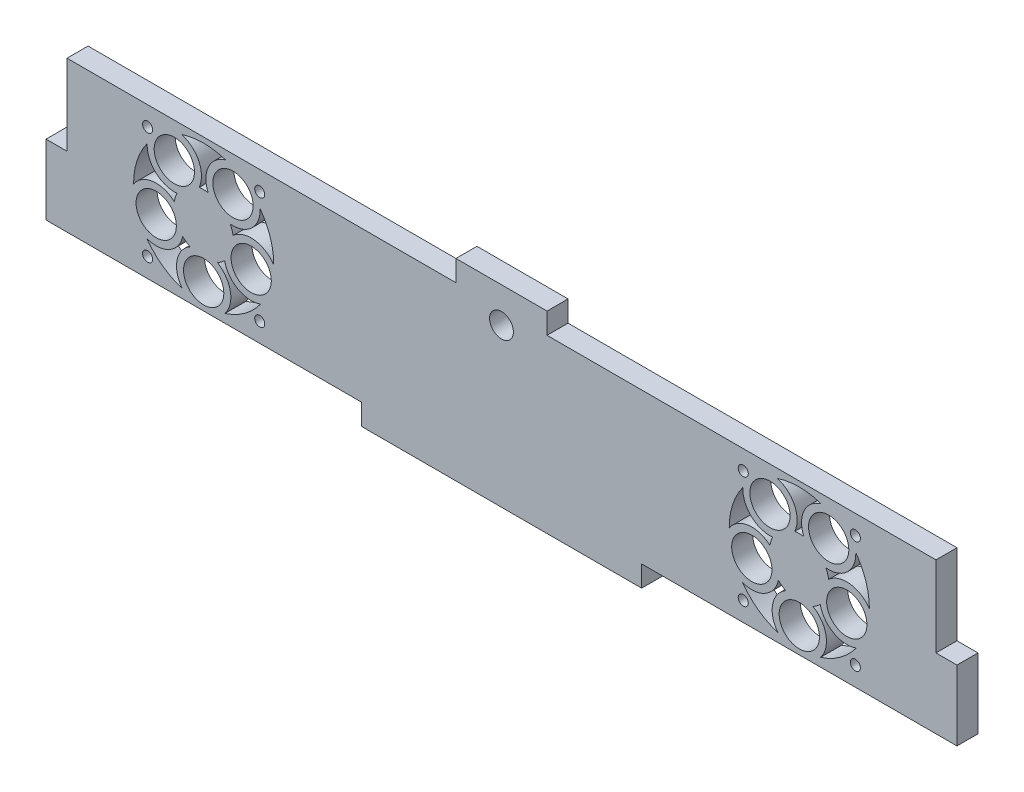
from build123d import *

# Parameters (mm, degrees)
SKETCH1_W                      = 260
SKETCH1_H                      = 49
BOSS_EXTRUDE1_DEPTH            = 6
SKETCH2_W                      = 117
SKETCH2_H                      = 6
CUT_EXTRUDE1_DEPTH             = 140.057542046
SKETCH5_W                      = 3.4
SKETCH5_H                      = 6
CUT_EXTRUDE2_REACH             = 141.058
SKETCH6_W                      = 6
SKETCH6_H                      = 23
SKETCH7_W                      = 80
SKETCH7_H                      = 6
BOSS_EXTRUDE2_DEPTH            = 6
SKETCH8_R                      = 20
SKETCH8_R_2                    = 8.5
CUT_EXTRUDE3_DEPTH             = 6
SKETCH9_R                      = 5.75
BOSS_EXTRUDE3_DEPTH            = 6
CIRPATTERN1_COUNT              = 5
SKETCH11_W                     = 1.4351
SKETCH11_H                     = 6
F_6_40_TAPPED_HOLE1_AT_2_COUNT = 2
F_6_40_TAPPED_HOLE1_AT_2_PITCH = 32
F_6_40_TAPPED_HOLE1_AT_3_COUNT = 2
F_6_40_TAPPED_HOLE1_AT_3_PITCH = 45.254833996
F_6_40_TAPPED_HOLE1_AT_4_COUNT = 2
F_6_40_TAPPED_HOLE1_AT_4_PITCH = 32
SKETCH12_R                     = 1.4351
SKETCH12_R_2                   = 3.4
SKETCH12_R_3                   = 5.75
CUT_EXTRUDE4_DEPTH             = 6


with BuildPart() as part:
    # Sketch1 → Boss-Extrude1 (new body)
    with BuildSketch(Plane.XY):
        with Locations((0, 24.5)):
            Rectangle(SKETCH1_W, SKETCH1_H)
    extrude(amount=BOSS_EXTRUDE1_DEPTH)

    # Sketch2 → Cut-Extrude1 (cut, through all)
    with BuildSketch(Plane(origin=(0, 0, 0), x_dir=(-1, 0, 0), z_dir=(0, 0, -1))):
        with Locations((-71.5, 46)):
            Rectangle(SKETCH2_W, SKETCH2_H)
        with Locations((71.5, 46)):
            Rectangle(SKETCH2_W, SKETCH2_H)
    extrude(amount=-CUT_EXTRUDE1_DEPTH, mode=Mode.SUBTRACT)

    # Sketch5 → M8x1.25 Tapped Hole1 (revolve, cut)
    with BuildSketch(Plane(origin=(0, 39, 0), x_dir=(0, 1, 0), z_dir=(1, 0, 0))):
        with Locations((1.7, 3)):
            Rectangle(SKETCH5_W, SKETCH5_H)
    revolve(axis=Axis((0, 39, -6.35), (0, 0, 1)), mode=Mode.SUBTRACT)

    # Sketch6 → Cut-Extrude2 (cut, up to next)
    with BuildSketch(Plane(origin=(0, 0, 0), x_dir=(-1, 0, 0), z_dir=(0, 0, -1)), mode=Mode.PRIVATE) as cut_extrude2_sk1:
        with Locations((-127, 31.5)):
            Rectangle(SKETCH6_W, SKETCH6_H)
    cut_extrude2_tool1 = extrude(cut_extrude2_sk1.sketch, amount=-CUT_EXTRUDE2_REACH, mode=Mode.PRIVATE) & part.part
    # Sketch6 → Cut-Extrude2 (cut, up to next)
    with BuildSketch(Plane(origin=(0, 0, 0), x_dir=(-1, 0, 0), z_dir=(0, 0, -1)), mode=Mode.PRIVATE) as cut_extrude2_sk2:
        with Locations((127, 31.5)):
            Rectangle(SKETCH6_W, SKETCH6_H)
    cut_extrude2_tool2 = extrude(cut_extrude2_sk2.sketch, amount=-CUT_EXTRUDE2_REACH, mode=Mode.PRIVATE) & part.part
    add(cut_extrude2_tool1.solids().sort_by_distance((127, 31.5, 0))[0], mode=Mode.SUBTRACT)
    add(cut_extrude2_tool2.solids().sort_by_distance((-127, 31.5, 0))[0], mode=Mode.SUBTRACT)

    # Sketch7 → Boss-Extrude2 (add)
    with BuildSketch(Plane(origin=(0, 0, 0), x_dir=(-1, 0, 0), z_dir=(0, 0, -1))):
        with Locations((0, -3)):
            Rectangle(SKETCH7_W, SKETCH7_H)
    extrude(amount=-BOSS_EXTRUDE2_DEPTH)

    # Sketch8 → Cut-Extrude3 (cut)
    with BuildSketch(Plane(origin=(0, 0, 0), x_dir=(-1, 0, 0), z_dir=(0, 0, -1))):
        with Locations((-85, 21.5)):
            Circle(SKETCH8_R)
        with Locations((-85, 21.5)):
            Circle(SKETCH8_R_2, mode=Mode.SUBTRACT)
    extrude(amount=-CUT_EXTRUDE3_DEPTH, mode=Mode.SUBTRACT)


with BuildPart() as cut_extrude3_piece_1:
    # of the separate pieces the step leaves, piece 1, a body of its own (cut_extrude3_pieces)
    add(part.part.solids().sort_by_distance((130, 0, 0))[0])



with BuildPart() as cut_extrude3_piece_2:
    # of the separate pieces the step leaves, piece 2, a body of its own (cut_extrude3_pieces)
    add(part.part.solids().sort_by_distance((76.5, 21.5, 0))[0])


with BuildPart() as cut_extrude3_piece_1_1:
    add(cut_extrude3_piece_1.part)

    add(cut_extrude3_piece_2.part)  # Boss-Extrude3 merges Cut-Extrude3 piece 2
    # Sketch9 → Boss-Extrude3 (add)
    with BuildSketch(Plane(origin=(0, 0, 0), x_dir=(-1, 0, 0), z_dir=(0, 0, -1))):
        with BuildLine():
            ThreePointArc((-100.761482737, 35.377163324), (-88.82060414, 26.758610463), (-93.327400585, 40.778340164))
            ThreePointArc((-93.327400585, 40.778340164), (-97.343490298, 38.489356882), (-100.761482737, 35.377163324))
        make_face()
        with Locations((-93.375939845, 33.02849217)):
            Circle(SKETCH9_R, mode=Mode.SUBTRACT)
    boss_extrude3 = extrude(amount=-BOSS_EXTRUDE3_DEPTH)

    # CirPattern1: Boss-Extrude3 ×5 about axis
    cirpattern1_axis = Axis((85, 21.5, 0), (0, 0, -1))
    for i in range(1, CIRPATTERN1_COUNT):
        add(boss_extrude3.rotate(cirpattern1_axis, i * 360 / CIRPATTERN1_COUNT))

    # Sketch11 → #6-40 Tapped Hole1 (revolve, cut)
    with BuildSketch(Plane(origin=(101, 37.5, 0), x_dir=(0, 1, 0), z_dir=(1, 0, 0))):
        with Locations((0.71755, 3)):
            Rectangle(SKETCH11_W, SKETCH11_H)
    f_6_40_tapped_hole1 = revolve(axis=Axis((101, 37.5, -6.35), (0, 0, 1)), mode=Mode.SUBTRACT)

    # #6-40 Tapped Hole1 at 2: #6-40 Tapped Hole1 ×2
    with Locations(*[(-i * F_6_40_TAPPED_HOLE1_AT_2_PITCH, 0, 0) for i in range(1, F_6_40_TAPPED_HOLE1_AT_2_COUNT)]):
        add(f_6_40_tapped_hole1, mode=Mode.SUBTRACT)

    # #6-40 Tapped Hole1 at 3: #6-40 Tapped Hole1 ×2
    with Locations(*[Vector(-0.7071067811865476, -0.7071067811865476, 0) * (i * F_6_40_TAPPED_HOLE1_AT_3_PITCH) for i in range(1, F_6_40_TAPPED_HOLE1_AT_3_COUNT)]):
        add(f_6_40_tapped_hole1, mode=Mode.SUBTRACT)

    # #6-40 Tapped Hole1 at 4: #6-40 Tapped Hole1 ×2
    with Locations(*[(0, -i * F_6_40_TAPPED_HOLE1_AT_4_PITCH, 0) for i in range(1, F_6_40_TAPPED_HOLE1_AT_4_COUNT)]):
        add(f_6_40_tapped_hole1, mode=Mode.SUBTRACT)

    # Sketch12 → Cut-Extrude4 (cut)
    with BuildSketch(Plane(origin=(0, 0, 0), x_dir=(-1, 0, 0), z_dir=(0, 0, -1))):
        with Locations(Location((101, 37.5, 0), (0, 0, 180))):
            Circle(SKETCH12_R)
        with Locations((0, 39)):
            Circle(SKETCH12_R_2)
        with Locations((-93.375939845, 33.02849217)):
            Circle(SKETCH12_R_3)
        with Locations(Location((-76.624060155, 33.02849217, 0), (0, 0, 288))):
            Circle(SKETCH12_R_3)
        with Locations(Location((-71.447444643, 17.09650783, 0), (0, 0, 216))):
            Circle(SKETCH12_R_3)
        with Locations(Location((-85, 7.25, 0), (0, 0, 144))):
            Circle(SKETCH12_R_3)
        with Locations(Location((-98.552555357, 17.09650783, 0), (0, 0, 72))):
            Circle(SKETCH12_R_3)
        with Locations((-101, 5.5)):
            Circle(SKETCH12_R)
        with Locations((-69, 5.5)):
            Circle(SKETCH12_R)
        with Locations((-69, 37.5)):
            Circle(SKETCH12_R)
        with Locations((-101, 37.5)):
            Circle(SKETCH12_R)
        with Locations(Location((69, 37.5, 0), (0, 0, 180))):
            Circle(SKETCH12_R)
        with Locations(Location((69, 5.5, 0), (0, 0, 180))):
            Circle(SKETCH12_R)
        with Locations(Location((101, 5.5, 0), (0, 0, 180))):
            Circle(SKETCH12_R)
        with Locations(Location((98.552555357, 17.09650783, 0), (0, 0, 180))):
            Circle(SKETCH12_R_3)
        with Locations(Location((85, 7.25, 0), (0, 0, 180))):
            Circle(SKETCH12_R_3)
        with Locations(Location((71.447444643, 17.09650783, 0), (0, 0, 180))):
            Circle(SKETCH12_R_3)
        with Locations(Location((76.624060155, 33.02849217, 0), (0, 0, 180))):
            Circle(SKETCH12_R_3)
        with Locations(Location((93.375939845, 33.02849217, 0), (0, 0, 180))):
            Circle(SKETCH12_R_3)
        with BuildLine():
            ThreePointArc((-78.722018184, 40.489127003), (-83.633443041, 36.334706252), (-83.715608088, 29.902400694))
            ThreePointArc((-83.715608088, 29.902400694), (-85, 30), (-86.284391912, 29.902400694))
            ThreePointArc((-86.284391912, 29.902400694), (-86.366556959, 36.334706252), (-91.277981816, 40.489127003))
            ThreePointArc((-91.277981816, 40.489127003), (-85, 41.5), (-78.722018184, 40.489127003))
        make_face()
        with BuildLine():
            ThreePointArc((-65.000263954, 21.397247437), (-65.978869674, 27.680339887), (-68.880270097, 33.338678467))
            ThreePointArc((-68.880270097, 33.338678467), (-71.313645276, 27.383849239), (-77.405740996, 25.318013906))
            ThreePointArc((-77.405740996, 25.318013906), (-76.916019611, 24.126644452), (-76.611943139, 22.87495531))
            ThreePointArc((-76.611943139, 22.87495531), (-70.469066627, 24.784503438), (-65.000263954, 21.397247437))
        make_face()
        with BuildLine():
            ThreePointArc((-78.917465173, 2.447368421), (-73.244294954, 5.319660113), (-68.759477215, 9.827578672))
            ThreePointArc((-68.759477215, 9.827578672), (-75.174810639, 10.301712562), (-79.022097904, 15.45726167))
            ThreePointArc((-79.022097904, 15.45726167), (-80.003825356, 14.623355548), (-81.100287673, 13.947368421))
            ThreePointArc((-81.100287673, 13.947368421), (-77.385946247, 8.695228508), (-78.917465173, 2.447368421))
        make_face()
        with BuildLine():
            ThreePointArc((-93.388056861, 22.87495531), (-99.530933373, 24.784503438), (-104.999736046, 21.397247437))
            ThreePointArc((-104.999736046, 21.397247437), (-104.021130326, 27.680339887), (-101.119729903, 33.338678467))
            ThreePointArc((-101.119729903, 33.338678467), (-98.686354724, 27.383849239), (-92.594259004, 25.318013906))
            ThreePointArc((-92.594259004, 25.318013906), (-93.083980389, 24.126644452), (-93.388056861, 22.87495531))
        make_face()
        with BuildLine():
            ThreePointArc((-101.240522785, 9.827578672), (-96.755705046, 5.319660113), (-91.082534827, 2.447368421))
            ThreePointArc((-91.082534827, 2.447368421), (-92.614053753, 8.695228508), (-88.899712327, 13.947368421))
            ThreePointArc((-88.899712327, 13.947368421), (-89.996174644, 14.623355548), (-90.977902096, 15.45726167))
            ThreePointArc((-90.977902096, 15.45726167), (-94.825189361, 10.301712562), (-101.240522785, 9.827578672))
        make_face()
        with BuildLine():
            ThreePointArc((88.899712327, 13.947368421), (92.614053753, 8.695228508), (91.082534827, 2.447368421))
            ThreePointArc((91.082534827, 2.447368421), (96.755705046, 5.319660113), (101.240522785, 9.827578672))
            ThreePointArc((101.240522785, 9.827578672), (94.825189361, 10.301712562), (90.977902096, 15.45726167))
            ThreePointArc((90.977902096, 15.45726167), (89.996174644, 14.623355548), (88.899712327, 13.947368421))
        make_face()
        with BuildLine():
            ThreePointArc((92.594259004, 25.318013906), (93.083980389, 24.126644452), (93.388056861, 22.87495531))
            ThreePointArc((93.388056861, 22.87495531), (99.530933373, 24.784503438), (104.999736046, 21.397247437))
            ThreePointArc((104.999736046, 21.397247437), (104.021130326, 27.680339887), (101.119729903, 33.338678467))
            ThreePointArc((101.119729903, 33.338678467), (98.686354724, 27.383849239), (92.594259004, 25.318013906))
        make_face()
        with BuildLine():
            ThreePointArc((79.022097904, 15.45726167), (75.174810639, 10.301712562), (68.759477215, 9.827578672))
            ThreePointArc((68.759477215, 9.827578672), (73.244294954, 5.319660113), (78.917465173, 2.447368421))
            ThreePointArc((78.917465173, 2.447368421), (77.385946247, 8.695228508), (81.100287673, 13.947368421))
            ThreePointArc((81.100287673, 13.947368421), (80.003825356, 14.623355548), (79.022097904, 15.45726167))
        make_face()
        with BuildLine():
            ThreePointArc((77.405740996, 25.318013906), (71.313645276, 27.383849239), (68.880270097, 33.338678467))
            ThreePointArc((68.880270097, 33.338678467), (65.978869674, 27.680339887), (65.000263954, 21.397247437))
            ThreePointArc((65.000263954, 21.397247437), (70.469066627, 24.784503438), (76.611943139, 22.87495531))
            ThreePointArc((76.611943139, 22.87495531), (76.916019611, 24.126644452), (77.405740996, 25.318013906))
        make_face()
        with BuildLine():
            ThreePointArc((78.722018184, 40.489127003), (85, 41.5), (91.277981816, 40.489127003))
            ThreePointArc((91.277981816, 40.489127003), (86.366556959, 36.334706252), (86.284391912, 29.902400694))
            ThreePointArc((86.284391912, 29.902400694), (85, 30), (83.715608088, 29.902400694))
            ThreePointArc((83.715608088, 29.902400694), (83.633443041, 36.334706252), (78.722018184, 40.489127003))
        make_face()
    extrude(amount=-CUT_EXTRUDE4_DEPTH, mode=Mode.SUBTRACT)


solid = cut_extrude3_piece_1_1.part
